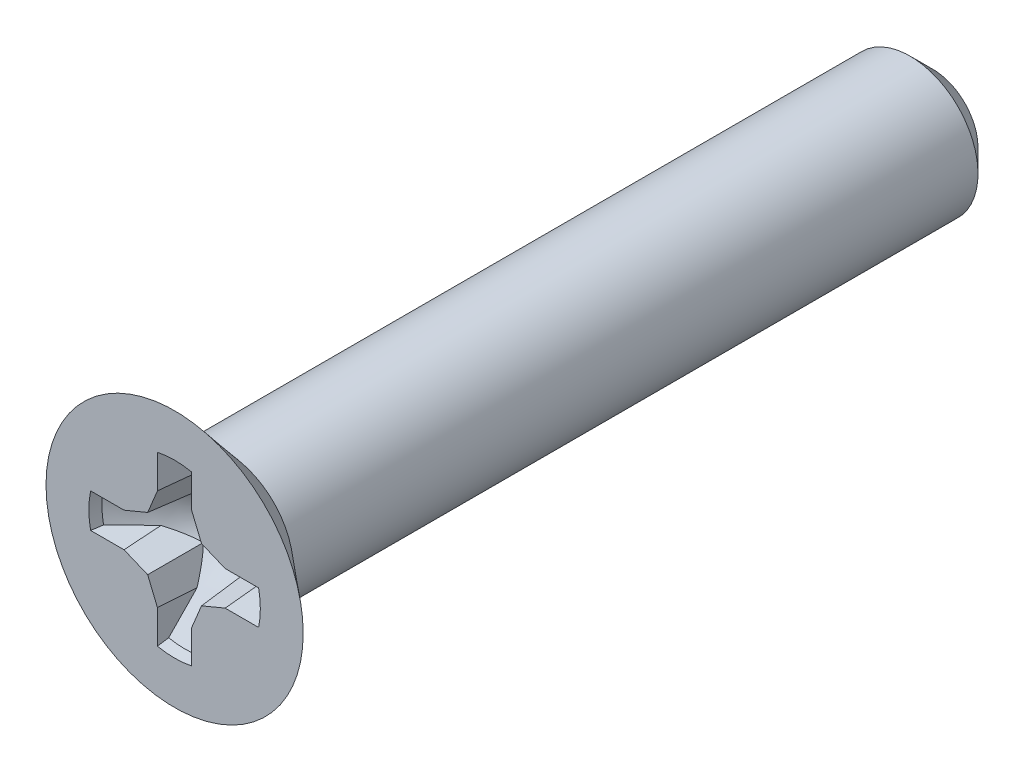
from build123d import *

# Parameters (mm, degrees)
SKETCH1_R          = 2.6924
EXTRUDE3_DEPTH     = 1.2446
SKETCH4_W          = 15.875
SKETCH4_H          = 1.4224
CHAMFER1_SIZE      = 0.47625
SKETCH26_R         = 0.7112
EXTRUDE8_DEPTH     = 1.2446
CUT_EXTRUDE3_REACH = 18.325
CIRPATTERN1_COUNT  = 4
DRAFT2_ANGLE       = 5


# Read off the part's stored shape, not the designer's step: Extrude10, Draft1
with BuildPart() as part:
    # Sketch1 → Extrude3 (new body)
    with BuildSketch(Plane.XY):
        Circle(SKETCH1_R)
    extrude(amount=EXTRUDE3_DEPTH)

    # Sketch11 → Cut-Revolve3 (revolve, cut)
    with BuildSketch(Plane(origin=(0, 0, 0), x_dir=(0, 0, -1), z_dir=(1, 0, 0)), mode=Mode.PRIVATE) as cut_revolve3_sk:
        Polygon((0, 1.209143479), (-1.2446, 2.6924), (0, 2.6924), align=None)
    revolve(cut_revolve3_sk.sketch.rotate(Axis((0, 0, -0.441444004), (0, 0, 1)), 90), axis=Axis((0, 0, -0.441444004), (0, 0, 1)), mode=Mode.SUBTRACT)

    # Extrude10 outline → Extrude10 (revolve)
    with BuildSketch(Plane.XZ):
        Polygon((1.4224, 0), (1.4224, 0.178943468), (1.209143479, 0.178943468), (1.209143479, 0), (0, 0), (0, -1.4224), align=None)
    revolve(axis=Axis((0, 0, 0), (0, 0, 1)))



with BuildPart() as body_2:
    # Sketch4 → Revolve1 (revolve)
    with BuildSketch(Plane(origin=(0, 0, 0), x_dir=(0, 0, -1), z_dir=(1, 0, 0)), mode=Mode.PRIVATE) as revolve1_sk:
        with Locations((6.6929, 0.7112)):
            Rectangle(SKETCH4_W, SKETCH4_H)
    revolve(revolve1_sk.sketch.rotate(Axis((0, 0, 1.2446), (0, 0, -1)), 180), axis=Axis((0, 0, 1.2446), (0, 0, -1)))

    # Chamfer1
    chamfer1_edges = [body_2.edges().sort_by_distance(p)[0] for p in [
        (0, 1.4224, -14.6304),
    ]]
    chamfer(chamfer1_edges, length=CHAMFER1_SIZE)


with BuildPart() as part_1:
    add(part.part)

    add(body_2.part)  # Extrude8 merges body 2
    # Sketch26 → Extrude8 (add)
    with BuildSketch(Plane.XY.offset(1.2446)):
        Circle(SKETCH26_R)
    extrude(amount=-EXTRUDE8_DEPTH)

    # Cut-Extrude3: up to this cone (the profile starts inside it)
    cut_extrude3_end = Plane(origin=(0, 0, 1.2446), z_dir=(0, 0, 1)).offset(-1.673411083) * Cone(1.192e-06, 26.805764308, 22.492705944, align=(Align.CENTER, Align.CENTER, Align.MIN), mode=Mode.PRIVATE)
    # Sketch12 → Cut-Extrude3 (cut, up to the surface)
    with BuildSketch(Plane.XY.offset(1.2446), mode=Mode.PRIVATE) as cut_extrude3_sk1:
        with BuildLine():
            Line((1.758668316, 0.358986667), (1.058827491, 0.358986667))
            Line((1.058827491, 0.358986667), (0.563965298, 0.563965298))
            Line((0.563965298, 0.563965298), (0.358986667, 1.058827491))
            Line((0.358986667, 1.058827491), (0.358986667, 1.758668316))
            ThreePointArc((0.358986667, 1.758668316), (0.180406886, 1.785844066), (0, 1.794933333))
            Line((0, 1.794933333), (0, 0))
            Line((0, 0), (1.794933333, 0))
            ThreePointArc((1.794933333, 0), (1.785844066, 0.180406886), (1.758668316, 0.358986667))
        make_face()
    cut_extrude3_tool1 = extrude(cut_extrude3_sk1.sketch, amount=-CUT_EXTRUDE3_REACH, mode=Mode.PRIVATE) & cut_extrude3_end
    cut_extrude3 = cut_extrude3_tool1.solids().sort_by_distance((1.408748, 0.333602, 1.2446))[0]
    add(cut_extrude3, mode=Mode.SUBTRACT)

    # CirPattern1: Cut-Extrude3 ×4 about axis
    cirpattern1_axis = Axis((0, 0, 0), (0, 0, 1))
    for i in range(1, CIRPATTERN1_COUNT):
        add(cut_extrude3.rotate(cirpattern1_axis, i * 360 / CIRPATTERN1_COUNT), mode=Mode.SUBTRACT)

    # Draft1 outline → Draft1 (revolve)
    with BuildSketch(Plane.XZ):
        Polygon((1.794933333, 1.2446), (1.737108581, 1.028795087), (1.794933333, 1.028795087), align=None)
    revolve(axis=Axis((0, 0, 0), (0, 0, 1)))

    # Draft2
    draft2_faces = [part_1.faces().sort_by_distance(p)[0] for p in [
        (0.358986667, 1.329150829, 0.986428177),
        (0.466729534, 0.798713199, 0.799402029),
        (0.798713199, 0.466729534, 0.799402029),
        (1.329150829, 0.358986667, 0.986428177),
        (1.329150829, -0.358986667, 0.986428177),
        (0.798713199, -0.466729534, 0.799402029),
        (0.466729534, -0.798713199, 0.799402029),
        (0.358986667, -1.329150829, 0.986428177),
        (-0.358986667, -1.329150829, 0.986428177),
        (-0.466729534, -0.798713199, 0.799402029),
        (-0.798713199, -0.466729534, 0.799402029),
        (-1.329150829, -0.358986667, 0.986428177),
        (-1.329150829, 0.358986667, 0.986428177),
        (-0.798713199, 0.466729534, 0.799402029),
        (-0.466729534, 0.798713199, 0.799402029),
        (-0.358986667, 1.329150829, 0.986428177),
    ]]
    draft(draft2_faces, Plane(origin=(0, 1.4224, 1.2446), x_dir=(0, 1, 0), z_dir=(0, 0, 1)), DRAFT2_ANGLE)


solid = part_1.part
